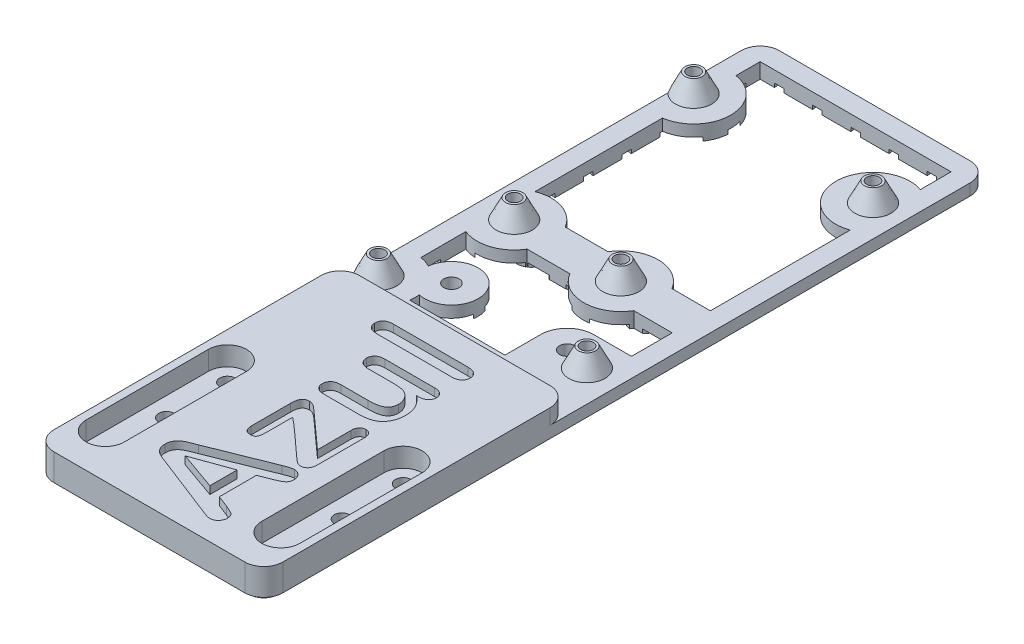
from build123d import *

# Parameters (mm, degrees)
SKETCH1_W           = 60
SKETCH1_H           = 190
SKETCH1_R           = 1.65
BOSS_EXTRUDE1_DEPTH = 4
SKETCH2_R           = 2.25
SKETCH2_R_2         = 1.65
BOSS_EXTRUDE2_DEPTH = 5
CHAMFER1_SIZE       = 2.5
CHAMFER1_SIZE_2     = 5
FILLET1_R           = 5
SKETCH4_R           = 3.75
CUT_EXTRUDE1_DEPTH  = 1
BOSS_EXTRUDE3_START = 4
BOSS_EXTRUDE3_DEPTH = 4
SKETCH7_R           = 2
CUT_EXTRUDE2_DEPTH  = 115.297856498
CUT_EXTRUDE3_DEPTH  = 5
SKETCH9_R           = 2
CUT_EXTRUDE4_DEPTH  = 115.127122105
SKETCH10_R          = 4
CUT_EXTRUDE5_DEPTH  = 115.127122105
CUT_EXTRUDE6_DEPTH  = 2
FILLET2_R           = 5
CUT_EXTRUDE7_DEPTH  = 115.127122136


with BuildPart() as part:
    # Sketch1 → Boss-Extrude1 (new body)
    with BuildSketch(Plane(origin=(0, 0, 0), x_dir=(1, 0, 0), z_dir=(0, 1, 0))):
        with Locations((0, 15)):
            Rectangle(SKETCH1_W, SKETCH1_H)
        with Locations(Location((-26.46, 89.03, 0), (0, 0, 270))):
            Circle(SKETCH1_R, mode=Mode.SUBTRACT)
        with Locations(Location((21.8, 87.76, 0), (0, 0, 270))):
            Circle(SKETCH1_R, mode=Mode.SUBTRACT)
        with Locations(Location((-21.38, 36.96, 0), (0, 0, 270))):
            Circle(SKETCH1_R, mode=Mode.SUBTRACT)
        with Locations(Location((6.56, 36.96, 0), (0, 0, 270))):
            Circle(SKETCH1_R, mode=Mode.SUBTRACT)
        with Locations(Location((-26.46, 6.48, 0), (0, 0, 270))):
            Circle(SKETCH1_R, mode=Mode.SUBTRACT)
        with Locations(Location((21.8, 12.83, 0), (0, 0, 270))):
            Circle(SKETCH1_R, mode=Mode.SUBTRACT)
    extrude(amount=BOSS_EXTRUDE1_DEPTH)

    # Sketch2 → Boss-Extrude2 (add)
    # profile 1 of 6: a face of its own
    with BuildSketch(Plane(origin=(0, 4, 0), x_dir=(1, 0, 0), z_dir=(0, 1, 0))):
        with Locations(Location((-26.46, 89.03, 0), (0, 0, 270))):
            Circle(SKETCH2_R)
        with Locations(Location((-26.46, 89.03, 0), (0, 0, 270))):
            Circle(SKETCH2_R_2, mode=Mode.SUBTRACT)
    # profile 2 of 6: a face of its own
    with BuildSketch(Plane(origin=(0, 4, 0), x_dir=(1, 0, 0), z_dir=(0, 1, 0))):
        with Locations(Location((21.8, 87.76, 0), (0, 0, 270))):
            Circle(SKETCH2_R)
        with Locations(Location((21.8, 87.76, 0), (0, 0, 270))):
            Circle(SKETCH2_R_2, mode=Mode.SUBTRACT)
    # profile 3 of 6: a face of its own
    with BuildSketch(Plane(origin=(0, 4, 0), x_dir=(1, 0, 0), z_dir=(0, 1, 0))):
        with Locations(Location((-21.38, 36.96, 0), (0, 0, 270))):
            Circle(SKETCH2_R)
        with Locations(Location((-21.38, 36.96, 0), (0, 0, 270))):
            Circle(SKETCH2_R_2, mode=Mode.SUBTRACT)
    # profile 4 of 6: a face of its own
    with BuildSketch(Plane(origin=(0, 4, 0), x_dir=(1, 0, 0), z_dir=(0, 1, 0))):
        with Locations(Location((6.56, 36.96, 0), (0, 0, 270))):
            Circle(SKETCH2_R)
        with Locations(Location((6.56, 36.96, 0), (0, 0, 270))):
            Circle(SKETCH2_R_2, mode=Mode.SUBTRACT)
    # profile 5 of 6: a face of its own
    with BuildSketch(Plane(origin=(0, 4, 0), x_dir=(1, 0, 0), z_dir=(0, 1, 0))):
        with Locations(Location((21.8, 12.83, 0), (0, 0, 270))):
            Circle(SKETCH2_R)
        with Locations(Location((21.8, 12.83, 0), (0, 0, 270))):
            Circle(SKETCH2_R_2, mode=Mode.SUBTRACT)
    # profile 6 of 6: a face of its own
    with BuildSketch(Plane(origin=(0, 4, 0), x_dir=(1, 0, 0), z_dir=(0, 1, 0))):
        with Locations(Location((-26.46, 6.48, 0), (0, 0, 270))):
            Circle(SKETCH2_R)
        with Locations(Location((-26.46, 6.48, 0), (0, 0, 270))):
            Circle(SKETCH2_R_2, mode=Mode.SUBTRACT)
    extrude(amount=BOSS_EXTRUDE2_DEPTH)

    # Chamfer1
    # the kernel refuses this chamfer: 5, 2.5 mm, written as the material it adds along each edge
    with BuildSketch(Plane(origin=(-26.46, 4, -89.03), x_dir=(0, 0, 1), z_dir=(-1, 0, 0))) as chamfer1_piece_1_section:
        Polygon((2.25 + CHAMFER1_SIZE, 0), (2.25, CHAMFER1_SIZE_2), (2.25, 0), align=None)
    chamfer1_piece_1 = revolve(axis=Axis((-26.46, 4, -89.03), (0, 1, 0)), mode=Mode.PRIVATE)
    chamfer1_piece_1 = split(chamfer1_piece_1, bisect_by=Plane(origin=(-30, 6.387860217, -92.529327231), z_dir=(1, 0, 0)), keep=Keep.TOP, mode=Mode.PRIVATE)
    chamfer1_piece_1 = split(chamfer1_piece_1, bisect_by=Plane(origin=(-26.46, 9, -92.529327231), z_dir=(0, -1, 0)), keep=Keep.TOP, mode=Mode.PRIVATE)
    add(chamfer1_piece_1)
    with BuildSketch(Plane(origin=(21.8, 4, -87.76), x_dir=(0, 0, 1), z_dir=(-1, 0, 0))) as chamfer1_piece_2_section:
        Polygon((2.25 + CHAMFER1_SIZE, 0), (2.25, CHAMFER1_SIZE_2), (2.25, 0), align=None)
    chamfer1_piece_2 = revolve(axis=Axis((21.8, 4, -87.76), (0, 1, 0)), mode=Mode.PRIVATE)
    chamfer1_piece_2 = split(chamfer1_piece_2, bisect_by=Plane(origin=(21.8, 9, -91.258639917), z_dir=(0, -1, 0)), keep=Keep.TOP, mode=Mode.PRIVATE)
    add(chamfer1_piece_2)
    with BuildSketch(Plane(origin=(-21.38, 4, -36.96), x_dir=(0, 0, 1), z_dir=(-1, 0, 0))) as chamfer1_piece_3_section:
        Polygon((2.25 + CHAMFER1_SIZE, 0), (2.25, CHAMFER1_SIZE_2), (2.25, 0), align=None)
    chamfer1_piece_3 = revolve(axis=Axis((-21.38, 4, -36.96), (0, 1, 0)), mode=Mode.PRIVATE)
    chamfer1_piece_3 = split(chamfer1_piece_3, bisect_by=Plane(origin=(-21.38, 9, -40.458639916), z_dir=(0, -1, 0)), keep=Keep.TOP, mode=Mode.PRIVATE)
    add(chamfer1_piece_3)
    with BuildSketch(Plane(origin=(6.56, 4, -36.96), x_dir=(0, 0, 1), z_dir=(-1, 0, 0))) as chamfer1_piece_4_section:
        Polygon((2.25 + CHAMFER1_SIZE, 0), (2.25, CHAMFER1_SIZE_2), (2.25, 0), align=None)
    chamfer1_piece_4 = revolve(axis=Axis((6.56, 4, -36.96), (0, 1, 0)), mode=Mode.PRIVATE)
    chamfer1_piece_4 = split(chamfer1_piece_4, bisect_by=Plane(origin=(6.56, 9, -40.458639914), z_dir=(0, -1, 0)), keep=Keep.TOP, mode=Mode.PRIVATE)
    add(chamfer1_piece_4)
    with BuildSketch(Plane(origin=(21.8, 4, -12.83), x_dir=(0, 0, 1), z_dir=(-1, 0, 0))) as chamfer1_piece_5_section:
        Polygon((2.25 + CHAMFER1_SIZE, 0), (2.25, CHAMFER1_SIZE_2), (2.25, 0), align=None)
    chamfer1_piece_5 = revolve(axis=Axis((21.8, 4, -12.83), (0, 1, 0)), mode=Mode.PRIVATE)
    chamfer1_piece_5 = split(chamfer1_piece_5, bisect_by=Plane(origin=(21.8, 9, -16.328639917), z_dir=(0, -1, 0)), keep=Keep.TOP, mode=Mode.PRIVATE)
    add(chamfer1_piece_5)
    with BuildSketch(Plane(origin=(-26.46, 4, -6.48), x_dir=(0, 0, 1), z_dir=(-1, 0, 0))) as chamfer1_piece_6_section:
        Polygon((2.25 + CHAMFER1_SIZE, 0), (2.25, CHAMFER1_SIZE_2), (2.25, 0), align=None)
    chamfer1_piece_6 = revolve(axis=Axis((-26.46, 4, -6.48), (0, 1, 0)), mode=Mode.PRIVATE)
    chamfer1_piece_6 = split(chamfer1_piece_6, bisect_by=Plane(origin=(-30, 6.387860216, -9.97932723), z_dir=(1, 0, 0)), keep=Keep.TOP, mode=Mode.PRIVATE)
    chamfer1_piece_6 = split(chamfer1_piece_6, bisect_by=Plane(origin=(-26.46, 9, -9.97932723), z_dir=(0, -1, 0)), keep=Keep.TOP, mode=Mode.PRIVATE)
    add(chamfer1_piece_6)

    # Fillet1
    fillet1_edges = [part.edges().sort_by_distance(p)[0] for p in [
        (30, 2, 80),
        (-30, 2, 80),
        (-30, 2, -110),
        (30, 2, -110),
    ]]
    fillet(fillet1_edges, radius=FILLET1_R)

    # Sketch4 → Cut-Extrude1 (cut)
    # profile 1 of 115: a face of its own
    with BuildSketch(Plane.XZ):
        with Locations((-85, 75)):
            Circle(SKETCH4_R)
    # profile 2 of 115: a face of its own
    with BuildSketch(Plane.XZ):
        with Locations((-75, 75)):
            Circle(SKETCH4_R)
    # profile 3 of 115: a face of its own
    with BuildSketch(Plane.XZ):
        with Locations((-65, 75)):
            Circle(SKETCH4_R)
    # profile 4 of 115: a face of its own
    with BuildSketch(Plane.XZ):
        with Locations((-55, 75)):
            Circle(SKETCH4_R)
    # profile 5 of 115: a face of its own
    with BuildSketch(Plane.XZ):
        with Locations((-45, 75)):
            Circle(SKETCH4_R)
    # profile 6 of 115: a face of its own
    with BuildSketch(Plane.XZ):
        with Locations((-35, 75)):
            Circle(SKETCH4_R)
    # profile 7 of 115: a face of its own
    with BuildSketch(Plane.XZ):
        with Locations((-75, 65)):
            Circle(SKETCH4_R)
    # profile 8 of 115: a face of its own
    with BuildSketch(Plane.XZ):
        with Locations((-65, 65)):
            Circle(SKETCH4_R)
    # profile 9 of 115: a face of its own
    with BuildSketch(Plane.XZ):
        with Locations((-55, 65)):
            Circle(SKETCH4_R)
    # profile 10 of 115: a face of its own
    with BuildSketch(Plane.XZ):
        with Locations((-45, 65)):
            Circle(SKETCH4_R)
    # profile 11 of 115: a face of its own
    with BuildSketch(Plane.XZ):
        with Locations((-35, 65)):
            Circle(SKETCH4_R)
    # profile 12 of 115: a face of its own
    with BuildSketch(Plane.XZ):
        with Locations((-75, 55)):
            Circle(SKETCH4_R)
    # profile 13 of 115: a face of its own
    with BuildSketch(Plane.XZ):
        with Locations((-65, 55)):
            Circle(SKETCH4_R)
    # profile 14 of 115: a face of its own
    with BuildSketch(Plane.XZ):
        with Locations((-55, 55)):
            Circle(SKETCH4_R)
    # profile 15 of 115: a face of its own
    with BuildSketch(Plane.XZ):
        with Locations((-45, 55)):
            Circle(SKETCH4_R)
    # profile 16 of 115: a face of its own
    with BuildSketch(Plane.XZ):
        with Locations((-35, 55)):
            Circle(SKETCH4_R)
    # profile 17 of 115: a face of its own
    with BuildSketch(Plane.XZ):
        with Locations((-75, 45)):
            Circle(SKETCH4_R)
    # profile 18 of 115: a face of its own
    with BuildSketch(Plane.XZ):
        with Locations((-65, 45)):
            Circle(SKETCH4_R)
    # profile 19 of 115: a face of its own
    with BuildSketch(Plane.XZ):
        with Locations((-55, 45)):
            Circle(SKETCH4_R)
    # profile 20 of 115: a face of its own
    with BuildSketch(Plane.XZ):
        with Locations((-45, 45)):
            Circle(SKETCH4_R)
    # profile 21 of 115: a face of its own
    with BuildSketch(Plane.XZ):
        with Locations((-35, 45)):
            Circle(SKETCH4_R)
    # profile 22 of 115: a face of its own
    with BuildSketch(Plane.XZ):
        with Locations((-75, 35)):
            Circle(SKETCH4_R)
    # profile 23 of 115: a face of its own
    with BuildSketch(Plane.XZ):
        with Locations((-65, 35)):
            Circle(SKETCH4_R)
    # profile 24 of 115: a face of its own
    with BuildSketch(Plane.XZ):
        with Locations((-55, 35)):
            Circle(SKETCH4_R)
    # profile 25 of 115: a face of its own
    with BuildSketch(Plane.XZ):
        with Locations((-45, 35)):
            Circle(SKETCH4_R)
    # profile 26 of 115: a face of its own
    with BuildSketch(Plane.XZ):
        with Locations((-35, 35)):
            Circle(SKETCH4_R)
    # profile 27 of 115: a face of its own
    with BuildSketch(Plane.XZ):
        with Locations((-75, 25)):
            Circle(SKETCH4_R)
    # profile 28 of 115: a face of its own
    with BuildSketch(Plane.XZ):
        with Locations((-65, 25)):
            Circle(SKETCH4_R)
    # profile 29 of 115: a face of its own
    with BuildSketch(Plane.XZ):
        with Locations((-55, 25)):
            Circle(SKETCH4_R)
    # profile 30 of 115: a face of its own
    with BuildSketch(Plane.XZ):
        with Locations((-45, 25)):
            Circle(SKETCH4_R)
    # profile 31 of 115: a face of its own
    with BuildSketch(Plane.XZ):
        with Locations((-35, 25)):
            Circle(SKETCH4_R)
    # profile 32 of 115: a face of its own
    with BuildSketch(Plane.XZ):
        with Locations((-75, 15)):
            Circle(SKETCH4_R)
    # profile 33 of 115: a face of its own
    with BuildSketch(Plane.XZ):
        with Locations((-65, 15)):
            Circle(SKETCH4_R)
    # profile 34 of 115: a face of its own
    with BuildSketch(Plane.XZ):
        with Locations((-55, 15)):
            Circle(SKETCH4_R)
    # profile 35 of 115: a face of its own
    with BuildSketch(Plane.XZ):
        with Locations((-45, 15)):
            Circle(SKETCH4_R)
    # profile 36 of 115: a face of its own
    with BuildSketch(Plane.XZ):
        with Locations((-35, 15)):
            Circle(SKETCH4_R)
    # profile 37 of 115: a face of its own
    with BuildSketch(Plane.XZ):
        with Locations((-75, 5)):
            Circle(SKETCH4_R)
    # profile 38 of 115: a face of its own
    with BuildSketch(Plane.XZ):
        with Locations((-65, 5)):
            Circle(SKETCH4_R)
    # profile 39 of 115: a face of its own
    with BuildSketch(Plane.XZ):
        with Locations((-55, 5)):
            Circle(SKETCH4_R)
    # profile 40 of 115: a face of its own
    with BuildSketch(Plane.XZ):
        with Locations((-45, 5)):
            Circle(SKETCH4_R)
    # profile 41 of 115: a face of its own
    with BuildSketch(Plane.XZ):
        with Locations((-35, 5)):
            Circle(SKETCH4_R)
    # profile 42 of 115: a face of its own
    with BuildSketch(Plane.XZ):
        with Locations((-75, -5)):
            Circle(SKETCH4_R)
    # profile 43 of 115: a face of its own
    with BuildSketch(Plane.XZ):
        with Locations((-65, -5)):
            Circle(SKETCH4_R)
    # profile 44 of 115: a face of its own
    with BuildSketch(Plane.XZ):
        with Locations((-55, -5)):
            Circle(SKETCH4_R)
    # profile 45 of 115: a face of its own
    with BuildSketch(Plane.XZ):
        with Locations((-45, -5)):
            Circle(SKETCH4_R)
    # profile 46 of 115: a face of its own
    with BuildSketch(Plane.XZ):
        with Locations((-35, -5)):
            Circle(SKETCH4_R)
    # profile 47 of 115: a face of its own
    with BuildSketch(Plane.XZ):
        with Locations((-75, -15)):
            Circle(SKETCH4_R)
    # profile 48 of 115: a face of its own
    with BuildSketch(Plane.XZ):
        with Locations((-65, -15)):
            Circle(SKETCH4_R)
    # profile 49 of 115: a face of its own
    with BuildSketch(Plane.XZ):
        with Locations((-55, -15)):
            Circle(SKETCH4_R)
    # profile 50 of 115: a face of its own
    with BuildSketch(Plane.XZ):
        with Locations((-45, -15)):
            Circle(SKETCH4_R)
    # profile 51 of 115: a face of its own
    with BuildSketch(Plane.XZ):
        with Locations((-35, -15)):
            Circle(SKETCH4_R)
    # profile 52 of 115: a face of its own
    with BuildSketch(Plane.XZ):
        with Locations((-75, -25)):
            Circle(SKETCH4_R)
    # profile 53 of 115: a face of its own
    with BuildSketch(Plane.XZ):
        with Locations((-65, -25)):
            Circle(SKETCH4_R)
    # profile 54 of 115: a face of its own
    with BuildSketch(Plane.XZ):
        with Locations((-55, -25)):
            Circle(SKETCH4_R)
    # profile 55 of 115: a face of its own
    with BuildSketch(Plane.XZ):
        with Locations((-45, -25)):
            Circle(SKETCH4_R)
    # profile 56 of 115: a face of its own
    with BuildSketch(Plane.XZ):
        with Locations((-35, -25)):
            Circle(SKETCH4_R)
    # profile 57 of 115: a face of its own
    with BuildSketch(Plane.XZ):
        with Locations((-85, 65)):
            Circle(SKETCH4_R)
    # profile 58 of 115: a face of its own
    with BuildSketch(Plane.XZ):
        with Locations((-85, 55)):
            Circle(SKETCH4_R)
    # profile 59 of 115: a face of its own
    with BuildSketch(Plane.XZ):
        with Locations((-85, 45)):
            Circle(SKETCH4_R)
    # profile 60 of 115: a face of its own
    with BuildSketch(Plane.XZ):
        with Locations((-85, 35)):
            Circle(SKETCH4_R)
    # profile 61 of 115: a face of its own
    with BuildSketch(Plane.XZ):
        with Locations((-85, 25)):
            Circle(SKETCH4_R)
    # profile 62 of 115: a face of its own
    with BuildSketch(Plane.XZ):
        with Locations((-85, 15)):
            Circle(SKETCH4_R)
    # profile 63 of 115: a face of its own
    with BuildSketch(Plane.XZ):
        with Locations((-85, 5)):
            Circle(SKETCH4_R)
    # profile 64 of 115: a face of its own
    with BuildSketch(Plane.XZ):
        with Locations((-85, -5)):
            Circle(SKETCH4_R)
    # profile 65 of 115: a face of its own
    with BuildSketch(Plane.XZ):
        with Locations((-85, -15)):
            Circle(SKETCH4_R)
    # profile 66 of 115: a face of its own
    with BuildSketch(Plane.XZ):
        with Locations((-85, -25)):
            Circle(SKETCH4_R)
    # profile 67 of 115: a face of its own
    with BuildSketch(Plane.XZ):
        with Locations((-85, -35)):
            Circle(SKETCH4_R)
    # profile 68 of 115: a face of its own
    with BuildSketch(Plane.XZ):
        with Locations((-75, -35)):
            Circle(SKETCH4_R)
    # profile 69 of 115: a face of its own
    with BuildSketch(Plane.XZ):
        with Locations((-65, -35)):
            Circle(SKETCH4_R)
    # profile 70 of 115: a face of its own
    with BuildSketch(Plane.XZ):
        with Locations((-55, -35)):
            Circle(SKETCH4_R)
    # profile 71 of 115: a face of its own
    with BuildSketch(Plane.XZ):
        with Locations((-45, -35)):
            Circle(SKETCH4_R)
    # profile 72 of 115: a face of its own
    with BuildSketch(Plane.XZ):
        with Locations((-35, -35)):
            Circle(SKETCH4_R)
    # profile 73 of 115: a face of its own
    with BuildSketch(Plane.XZ):
        with Locations((-85, -45)):
            Circle(SKETCH4_R)
    # profile 74 of 115: a face of its own
    with BuildSketch(Plane.XZ):
        with Locations((-75, -45)):
            Circle(SKETCH4_R)
    # profile 75 of 115: a face of its own
    with BuildSketch(Plane.XZ):
        with Locations((-65, -45)):
            Circle(SKETCH4_R)
    # profile 76 of 115: a face of its own
    with BuildSketch(Plane.XZ):
        with Locations((-55, -45)):
            Circle(SKETCH4_R)
    # profile 77 of 115: a face of its own
    with BuildSketch(Plane.XZ):
        with Locations((-45, -45)):
            Circle(SKETCH4_R)
    # profile 78 of 115: a face of its own
    with BuildSketch(Plane.XZ):
        with Locations((-35, -45)):
            Circle(SKETCH4_R)
    # profile 79 of 115: a face of its own
    with BuildSketch(Plane.XZ):
        with Locations((-85, -55)):
            Circle(SKETCH4_R)
    # profile 80 of 115: a face of its own
    with BuildSketch(Plane.XZ):
        with Locations((-75, -55)):
            Circle(SKETCH4_R)
    # profile 81 of 115: a face of its own
    with BuildSketch(Plane.XZ):
        with Locations((-65, -55)):
            Circle(SKETCH4_R)
    # profile 82 of 115: a face of its own
    with BuildSketch(Plane.XZ):
        with Locations((-55, -55)):
            Circle(SKETCH4_R)
    # profile 83 of 115: a face of its own
    with BuildSketch(Plane.XZ):
        with Locations((-45, -55)):
            Circle(SKETCH4_R)
    # profile 84 of 115: a face of its own
    with BuildSketch(Plane.XZ):
        with Locations((-35, -55)):
            Circle(SKETCH4_R)
    # profile 85 of 115: a face of its own
    with BuildSketch(Plane.XZ):
        with Locations((-85, -65)):
            Circle(SKETCH4_R)
    # profile 86 of 115: a face of its own
    with BuildSketch(Plane.XZ):
        with Locations((-75, -65)):
            Circle(SKETCH4_R)
    # profile 87 of 115: a face of its own
    with BuildSketch(Plane.XZ):
        with Locations((-65, -65)):
            Circle(SKETCH4_R)
    # profile 88 of 115: a face of its own
    with BuildSketch(Plane.XZ):
        with Locations((-55, -65)):
            Circle(SKETCH4_R)
    # profile 89 of 115: a face of its own
    with BuildSketch(Plane.XZ):
        with Locations((-45, -65)):
            Circle(SKETCH4_R)
    # profile 90 of 115: a face of its own
    with BuildSketch(Plane.XZ):
        with Locations((-35, -65)):
            Circle(SKETCH4_R)
    # profile 91 of 115: a face of its own
    with BuildSketch(Plane.XZ):
        with Locations((-85, -75)):
            Circle(SKETCH4_R)
    # profile 92 of 115: a face of its own
    with BuildSketch(Plane.XZ):
        with Locations((-75, -75)):
            Circle(SKETCH4_R)
    # profile 93 of 115: a face of its own
    with BuildSketch(Plane.XZ):
        with Locations((-65, -75)):
            Circle(SKETCH4_R)
    # profile 94 of 115: a face of its own
    with BuildSketch(Plane.XZ):
        with Locations((-55, -75)):
            Circle(SKETCH4_R)
    # profile 95 of 115: a face of its own
    with BuildSketch(Plane.XZ):
        with Locations((-45, -75)):
            Circle(SKETCH4_R)
    # profile 96 of 115: a face of its own
    with BuildSketch(Plane.XZ):
        with Locations((-35, -75)):
            Circle(SKETCH4_R)
    # profile 97 of 115: a face of its own
    with BuildSketch(Plane.XZ):
        with Locations((-85, -85)):
            Circle(SKETCH4_R)
    # profile 98 of 115: a face of its own
    with BuildSketch(Plane.XZ):
        with Locations((-75, -85)):
            Circle(SKETCH4_R)
    # profile 99 of 115: a face of its own
    with BuildSketch(Plane.XZ):
        with Locations((-65, -85)):
            Circle(SKETCH4_R)
    # profile 100 of 115: a face of its own
    with BuildSketch(Plane.XZ):
        with Locations((-55, -85)):
            Circle(SKETCH4_R)
    # profile 101 of 115: a face of its own
    with BuildSketch(Plane.XZ):
        with Locations((-45, -85)):
            Circle(SKETCH4_R)
    # profile 102 of 115: a face of its own
    with BuildSketch(Plane.XZ):
        with Locations((-35, -85)):
            Circle(SKETCH4_R)
    # profile 103 of 115: a face of its own
    with BuildSketch(Plane.XZ):
        with Locations((-85, -95)):
            Circle(SKETCH4_R)
    # profile 104 of 115: a face of its own
    with BuildSketch(Plane.XZ):
        with Locations((-75, -95)):
            Circle(SKETCH4_R)
    # profile 105 of 115: a face of its own
    with BuildSketch(Plane.XZ):
        with Locations((-65, -95)):
            Circle(SKETCH4_R)
    # profile 106 of 115: a face of its own
    with BuildSketch(Plane.XZ):
        with Locations((-55, -95)):
            Circle(SKETCH4_R)
    # profile 107 of 115: a face of its own
    with BuildSketch(Plane.XZ):
        with Locations((-45, -95)):
            Circle(SKETCH4_R)
    # profile 108 of 115: a face of its own
    with BuildSketch(Plane.XZ):
        with Locations((-35, -95)):
            Circle(SKETCH4_R)
    # profile 109 of 115: a face of its own
    with BuildSketch(Plane.XZ):
        with Locations((-85, -105)):
            Circle(SKETCH4_R)
    # profile 110 of 115: a face of its own
    with BuildSketch(Plane.XZ):
        with Locations((-75, -105)):
            Circle(SKETCH4_R)
    # profile 111 of 115: a face of its own
    with BuildSketch(Plane.XZ):
        with Locations((-65, -105)):
            Circle(SKETCH4_R)
    # profile 112 of 115: a face of its own
    with BuildSketch(Plane.XZ):
        with Locations((-55, -105)):
            Circle(SKETCH4_R)
    # profile 113 of 115: a face of its own
    with BuildSketch(Plane.XZ):
        with Locations((-45, -105)):
            Circle(SKETCH4_R)
    # profile 114 of 115: a face of its own
    with BuildSketch(Plane.XZ):
        with Locations((-35, -105)):
            Circle(SKETCH4_R)
    # profile 115 of 115: a face of its own
    with BuildSketch(Plane.XZ):
        with BuildLine():
            Line((30, -105), (30, 75))
            ThreePointArc((30, 75), (28.535533906, 78.535533906), (25, 80))
            Line((25, 80), (-25, 80))
            ThreePointArc((-25, 80), (-28.535533906, 78.535533906), (-30, 75))
            Line((-30, 75), (-30, -105))
            ThreePointArc((-30, -105), (-28.535533906, -108.535533906), (-25, -110))
            Line((-25, -110), (25, -110))
            ThreePointArc((25, -110), (28.535533906, -108.535533906), (30, -105))
        make_face()
        with Locations(Location((-25, 75, 0), (0, 0, 270))):
            Circle(SKETCH4_R, mode=Mode.SUBTRACT)
        with Locations(Location((-15, 75, 0), (0, 0, 270))):
            Circle(SKETCH4_R, mode=Mode.SUBTRACT)
        with Locations(Location((-5, 75, 0), (0, 0, 270))):
            Circle(SKETCH4_R, mode=Mode.SUBTRACT)
        with Locations(Location((5, 75, 0), (0, 0, 270))):
            Circle(SKETCH4_R, mode=Mode.SUBTRACT)
        with Locations(Location((15, 75, 0), (0, 0, 270))):
            Circle(SKETCH4_R, mode=Mode.SUBTRACT)
        with Locations(Location((25, 75, 0), (0, 0, 270))):
            Circle(SKETCH4_R, mode=Mode.SUBTRACT)
        with Locations(Location((-25, 65, 0), (0, 0, 270))):
            Circle(SKETCH4_R, mode=Mode.SUBTRACT)
        with Locations(Location((-15, 65, 0), (0, 0, 270))):
            Circle(SKETCH4_R, mode=Mode.SUBTRACT)
        with Locations(Location((-5, 65, 0), (0, 0, 270))):
            Circle(SKETCH4_R, mode=Mode.SUBTRACT)
        with Locations(Location((5, 65, 0), (0, 0, 270))):
            Circle(SKETCH4_R, mode=Mode.SUBTRACT)
        with Locations(Location((15, 65, 0), (0, 0, 270))):
            Circle(SKETCH4_R, mode=Mode.SUBTRACT)
        with Locations(Location((25, 65, 0), (0, 0, 270))):
            Circle(SKETCH4_R, mode=Mode.SUBTRACT)
        with Locations(Location((-25, 55, 0), (0, 0, 270))):
            Circle(SKETCH4_R, mode=Mode.SUBTRACT)
        with Locations(Location((-15, 55, 0), (0, 0, 270))):
            Circle(SKETCH4_R, mode=Mode.SUBTRACT)
        with Locations(Location((-5, 55, 0), (0, 0, 270))):
            Circle(SKETCH4_R, mode=Mode.SUBTRACT)
        with Locations(Location((5, 55, 0), (0, 0, 270))):
            Circle(SKETCH4_R, mode=Mode.SUBTRACT)
        with Locations(Location((15, 55, 0), (0, 0, 270))):
            Circle(SKETCH4_R, mode=Mode.SUBTRACT)
        with Locations(Location((25, 55, 0), (0, 0, 270))):
            Circle(SKETCH4_R, mode=Mode.SUBTRACT)
        with Locations(Location((-25, 45, 0), (0, 0, 270))):
            Circle(SKETCH4_R, mode=Mode.SUBTRACT)
        with Locations(Location((-15, 45, 0), (0, 0, 270))):
            Circle(SKETCH4_R, mode=Mode.SUBTRACT)
        with Locations(Location((-5, 45, 0), (0, 0, 270))):
            Circle(SKETCH4_R, mode=Mode.SUBTRACT)
        with Locations(Location((5, 45, 0), (0, 0, 270))):
            Circle(SKETCH4_R, mode=Mode.SUBTRACT)
        with Locations(Location((15, 45, 0), (0, 0, 270))):
            Circle(SKETCH4_R, mode=Mode.SUBTRACT)
        with Locations(Location((25, 45, 0), (0, 0, 270))):
            Circle(SKETCH4_R, mode=Mode.SUBTRACT)
        with Locations(Location((-25, 35, 0), (0, 0, 270))):
            Circle(SKETCH4_R, mode=Mode.SUBTRACT)
        with Locations(Location((-15, 35, 0), (0, 0, 270))):
            Circle(SKETCH4_R, mode=Mode.SUBTRACT)
        with Locations(Location((-5, 35, 0), (0, 0, 270))):
            Circle(SKETCH4_R, mode=Mode.SUBTRACT)
        with Locations(Location((5, 35, 0), (0, 0, 270))):
            Circle(SKETCH4_R, mode=Mode.SUBTRACT)
        with Locations(Location((15, 35, 0), (0, 0, 270))):
            Circle(SKETCH4_R, mode=Mode.SUBTRACT)
        with Locations(Location((25, 35, 0), (0, 0, 270))):
            Circle(SKETCH4_R, mode=Mode.SUBTRACT)
        with Locations(Location((-25, 25, 0), (0, 0, 270))):
            Circle(SKETCH4_R, mode=Mode.SUBTRACT)
        with Locations(Location((-15, 25, 0), (0, 0, 270))):
            Circle(SKETCH4_R, mode=Mode.SUBTRACT)
        with Locations(Location((-5, 25, 0), (0, 0, 270))):
            Circle(SKETCH4_R, mode=Mode.SUBTRACT)
        with Locations(Location((5, 25, 0), (0, 0, 270))):
            Circle(SKETCH4_R, mode=Mode.SUBTRACT)
        with Locations(Location((15, 25, 0), (0, 0, 270))):
            Circle(SKETCH4_R, mode=Mode.SUBTRACT)
        with Locations(Location((25, 25, 0), (0, 0, 270))):
            Circle(SKETCH4_R, mode=Mode.SUBTRACT)
        with Locations(Location((-25, 15, 0), (0, 0, 270))):
            Circle(SKETCH4_R, mode=Mode.SUBTRACT)
        with Locations(Location((-15, 15, 0), (0, 0, 270))):
            Circle(SKETCH4_R, mode=Mode.SUBTRACT)
        with Locations(Location((-5, 15, 0), (0, 0, 270))):
            Circle(SKETCH4_R, mode=Mode.SUBTRACT)
        with Locations(Location((5, 15, 0), (0, 0, 270))):
            Circle(SKETCH4_R, mode=Mode.SUBTRACT)
        with Locations(Location((15, 15, 0), (0, 0, 270))):
            Circle(SKETCH4_R, mode=Mode.SUBTRACT)
        with Locations(Location((25, 15, 0), (0, 0, 270))):
            Circle(SKETCH4_R, mode=Mode.SUBTRACT)
        with Locations(Location((-25, 5, 0), (0, 0, 270))):
            Circle(SKETCH4_R, mode=Mode.SUBTRACT)
        with Locations(Location((-15, 5, 0), (0, 0, 270))):
            Circle(SKETCH4_R, mode=Mode.SUBTRACT)
        with Locations(Location((-5, 5, 0), (0, 0, 270))):
            Circle(SKETCH4_R, mode=Mode.SUBTRACT)
        with Locations(Location((5, 5, 0), (0, 0, 270))):
            Circle(SKETCH4_R, mode=Mode.SUBTRACT)
        with Locations(Location((15, 5, 0), (0, 0, 270))):
            Circle(SKETCH4_R, mode=Mode.SUBTRACT)
        with Locations(Location((25, 5, 0), (0, 0, 270))):
            Circle(SKETCH4_R, mode=Mode.SUBTRACT)
        with Locations(Location((-25, -5, 0), (0, 0, 270))):
            Circle(SKETCH4_R, mode=Mode.SUBTRACT)
        with Locations(Location((-15, -5, 0), (0, 0, 270))):
            Circle(SKETCH4_R, mode=Mode.SUBTRACT)
        with Locations(Location((-5, -5, 0), (0, 0, 270))):
            Circle(SKETCH4_R, mode=Mode.SUBTRACT)
        with Locations(Location((5, -5, 0), (0, 0, 270))):
            Circle(SKETCH4_R, mode=Mode.SUBTRACT)
        with Locations(Location((15, -5, 0), (0, 0, 270))):
            Circle(SKETCH4_R, mode=Mode.SUBTRACT)
        with Locations(Location((25, -5, 0), (0, 0, 270))):
            Circle(SKETCH4_R, mode=Mode.SUBTRACT)
        with Locations(Location((-25, -15, 0), (0, 0, 270))):
            Circle(SKETCH4_R, mode=Mode.SUBTRACT)
        with Locations(Location((-15, -15, 0), (0, 0, 270))):
            Circle(SKETCH4_R, mode=Mode.SUBTRACT)
        with Locations(Location((-5, -15, 0), (0, 0, 270))):
            Circle(SKETCH4_R, mode=Mode.SUBTRACT)
        with Locations(Location((5, -15, 0), (0, 0, 270))):
            Circle(SKETCH4_R, mode=Mode.SUBTRACT)
        with Locations(Location((15, -15, 0), (0, 0, 270))):
            Circle(SKETCH4_R, mode=Mode.SUBTRACT)
        with Locations((25, -15)):
            Circle(SKETCH4_R, mode=Mode.SUBTRACT)
        with Locations(Location((-25, -25, 0), (0, 0, 270))):
            Circle(SKETCH4_R, mode=Mode.SUBTRACT)
        with Locations(Location((-15, -25, 0), (0, 0, 270))):
            Circle(SKETCH4_R, mode=Mode.SUBTRACT)
        with Locations(Location((-5, -25, 0), (0, 0, 270))):
            Circle(SKETCH4_R, mode=Mode.SUBTRACT)
        with Locations(Location((5, -25, 0), (0, 0, 270))):
            Circle(SKETCH4_R, mode=Mode.SUBTRACT)
        with Locations(Location((15, -25, 0), (0, 0, 270))):
            Circle(SKETCH4_R, mode=Mode.SUBTRACT)
        with Locations(Location((25, -25, 0), (0, 0, 270))):
            Circle(SKETCH4_R, mode=Mode.SUBTRACT)
        with Locations((-25, -35)):
            Circle(SKETCH4_R, mode=Mode.SUBTRACT)
        with Locations(Location((-15, -35, 0), (0, 0, 270))):
            Circle(SKETCH4_R, mode=Mode.SUBTRACT)
        with Locations(Location((-5, -35, 0), (0, 0, 270))):
            Circle(SKETCH4_R, mode=Mode.SUBTRACT)
        with Locations((5, -35)):
            Circle(SKETCH4_R, mode=Mode.SUBTRACT)
        with Locations(Location((15, -35, 0), (0, 0, 270))):
            Circle(SKETCH4_R, mode=Mode.SUBTRACT)
        with Locations(Location((25, -35, 0), (0, 0, 270))):
            Circle(SKETCH4_R, mode=Mode.SUBTRACT)
        with Locations(Location((-25, -45, 0), (0, 0, 270))):
            Circle(SKETCH4_R, mode=Mode.SUBTRACT)
        with Locations(Location((-15, -45, 0), (0, 0, 270))):
            Circle(SKETCH4_R, mode=Mode.SUBTRACT)
        with Locations(Location((-5, -45, 0), (0, 0, 270))):
            Circle(SKETCH4_R, mode=Mode.SUBTRACT)
        with Locations(Location((5, -45, 0), (0, 0, 270))):
            Circle(SKETCH4_R, mode=Mode.SUBTRACT)
        with Locations(Location((15, -45, 0), (0, 0, 270))):
            Circle(SKETCH4_R, mode=Mode.SUBTRACT)
        with Locations(Location((25, -45, 0), (0, 0, 270))):
            Circle(SKETCH4_R, mode=Mode.SUBTRACT)
        with Locations(Location((-25, -55, 0), (0, 0, 270))):
            Circle(SKETCH4_R, mode=Mode.SUBTRACT)
        with Locations(Location((-15, -55, 0), (0, 0, 270))):
            Circle(SKETCH4_R, mode=Mode.SUBTRACT)
        with Locations(Location((-5, -55, 0), (0, 0, 270))):
            Circle(SKETCH4_R, mode=Mode.SUBTRACT)
        with Locations(Location((5, -55, 0), (0, 0, 270))):
            Circle(SKETCH4_R, mode=Mode.SUBTRACT)
        with Locations(Location((15, -55, 0), (0, 0, 270))):
            Circle(SKETCH4_R, mode=Mode.SUBTRACT)
        with Locations(Location((25, -55, 0), (0, 0, 270))):
            Circle(SKETCH4_R, mode=Mode.SUBTRACT)
        with Locations(Location((-25, -65, 0), (0, 0, 270))):
            Circle(SKETCH4_R, mode=Mode.SUBTRACT)
        with Locations(Location((-15, -65, 0), (0, 0, 270))):
            Circle(SKETCH4_R, mode=Mode.SUBTRACT)
        with Locations(Location((-5, -65, 0), (0, 0, 270))):
            Circle(SKETCH4_R, mode=Mode.SUBTRACT)
        with Locations(Location((5, -65, 0), (0, 0, 270))):
            Circle(SKETCH4_R, mode=Mode.SUBTRACT)
        with Locations(Location((15, -65, 0), (0, 0, 270))):
            Circle(SKETCH4_R, mode=Mode.SUBTRACT)
        with Locations(Location((25, -65, 0), (0, 0, 270))):
            Circle(SKETCH4_R, mode=Mode.SUBTRACT)
        with Locations(Location((-25, -75, 0), (0, 0, 270))):
            Circle(SKETCH4_R, mode=Mode.SUBTRACT)
        with Locations(Location((-15, -75, 0), (0, 0, 270))):
            Circle(SKETCH4_R, mode=Mode.SUBTRACT)
        with Locations(Location((-5, -75, 0), (0, 0, 270))):
            Circle(SKETCH4_R, mode=Mode.SUBTRACT)
        with Locations(Location((5, -75, 0), (0, 0, 270))):
            Circle(SKETCH4_R, mode=Mode.SUBTRACT)
        with Locations(Location((15, -75, 0), (0, 0, 270))):
            Circle(SKETCH4_R, mode=Mode.SUBTRACT)
        with Locations(Location((25, -75, 0), (0, 0, 270))):
            Circle(SKETCH4_R, mode=Mode.SUBTRACT)
        with Locations((-25, -85)):
            Circle(SKETCH4_R, mode=Mode.SUBTRACT)
        with Locations(Location((-15, -85, 0), (0, 0, 270))):
            Circle(SKETCH4_R, mode=Mode.SUBTRACT)
        with Locations(Location((-5, -85, 0), (0, 0, 270))):
            Circle(SKETCH4_R, mode=Mode.SUBTRACT)
        with Locations(Location((5, -85, 0), (0, 0, 270))):
            Circle(SKETCH4_R, mode=Mode.SUBTRACT)
        with Locations(Location((15, -85, 0), (0, 0, 270))):
            Circle(SKETCH4_R, mode=Mode.SUBTRACT)
        with Locations((25, -85)):
            Circle(SKETCH4_R, mode=Mode.SUBTRACT)
        with Locations(Location((-25, -95, 0), (0, 0, 270))):
            Circle(SKETCH4_R, mode=Mode.SUBTRACT)
        with Locations(Location((-15, -95, 0), (0, 0, 270))):
            Circle(SKETCH4_R, mode=Mode.SUBTRACT)
        with Locations(Location((-5, -95, 0), (0, 0, 270))):
            Circle(SKETCH4_R, mode=Mode.SUBTRACT)
        with Locations(Location((5, -95, 0), (0, 0, 270))):
            Circle(SKETCH4_R, mode=Mode.SUBTRACT)
        with Locations(Location((15, -95, 0), (0, 0, 270))):
            Circle(SKETCH4_R, mode=Mode.SUBTRACT)
        with Locations(Location((25, -95, 0), (0, 0, 270))):
            Circle(SKETCH4_R, mode=Mode.SUBTRACT)
        with Locations(Location((-25, -105, 0), (0, 0, 270))):
            Circle(SKETCH4_R, mode=Mode.SUBTRACT)
        with Locations(Location((-15, -105, 0), (0, 0, 270))):
            Circle(SKETCH4_R, mode=Mode.SUBTRACT)
        with Locations(Location((-5, -105, 0), (0, 0, 270))):
            Circle(SKETCH4_R, mode=Mode.SUBTRACT)
        with Locations(Location((5, -105, 0), (0, 0, 270))):
            Circle(SKETCH4_R, mode=Mode.SUBTRACT)
        with Locations(Location((15, -105, 0), (0, 0, 270))):
            Circle(SKETCH4_R, mode=Mode.SUBTRACT)
        with Locations(Location((25, -105, 0), (0, 0, 270))):
            Circle(SKETCH4_R, mode=Mode.SUBTRACT)
    extrude(amount=-CUT_EXTRUDE1_DEPTH, mode=Mode.SUBTRACT)

    # Sketch6 → Boss-Extrude3 (add)
    with BuildSketch(Plane(origin=(0, 4, 0), x_dir=(1, 0, 0), z_dir=(0, 1, 0)).offset(BOSS_EXTRUDE3_START)):
        with BuildLine():
            Line((-30, 0), (-30, -75))
            ThreePointArc((-30, -75), (-28.535533906, -78.535533906), (-25, -80))
            Line((-25, -80), (25, -80))
            ThreePointArc((25, -80), (28.535533906, -78.535533906), (30, -75))
            Line((30, -75), (30, 0))
            Line((30, 0), (-30, 0))
        make_face()
    extrude(amount=-BOSS_EXTRUDE3_DEPTH)

    # Sketch7 → Cut-Extrude2 (cut, through all)
    with BuildSketch(Plane(origin=(0, 8, 0), x_dir=(1, 0, 0), z_dir=(0, 1, 0))):
        with Locations(Location((23, -68.540077083, 0), (0, 0, 270))):
            Circle(SKETCH7_R)
        with Locations(Location((23, -52.540077083, 0), (0, 0, 270))):
            Circle(SKETCH7_R)
        with Locations(Location((23, -36.540077083, 0), (0, 0, 270))):
            Circle(SKETCH7_R)
        with Locations(Location((-23, -36.540077083, 0), (0, 0, 270))):
            Circle(SKETCH7_R)
        with Locations(Location((-23, -52.540077083, 0), (0, 0, 270))):
            Circle(SKETCH7_R)
        with Locations(Location((-23, -68.540077083, 0), (0, 0, 270))):
            Circle(SKETCH7_R)
    extrude(amount=-CUT_EXTRUDE2_DEPTH, mode=Mode.SUBTRACT)

    # Sketch8 → Cut-Extrude3 (cut)
    with BuildSketch(Plane(origin=(0, 8, 0), x_dir=(1, 0, 0), z_dir=(0, 1, 0))):
        with BuildLine():
            Line((-18, -36.540077083), (-18, -68.540077083))
            ThreePointArc((-18, -68.540077083), (-23, -73.540077083), (-28, -68.540077083))
            Line((-28, -68.540077083), (-28, -36.540077083))
            ThreePointArc((-28, -36.540077083), (-23, -31.540077083), (-18, -36.540077083))
        make_face()
        with BuildLine():
            Line((28, -36.540077083), (28, -68.540077083))
            ThreePointArc((28, -68.540077083), (23, -73.540077083), (18, -68.540077083))
            Line((18, -68.540077083), (18, -36.540077083))
            ThreePointArc((18, -36.540077083), (23, -31.540077083), (28, -36.540077083))
        make_face()
    extrude(amount=-CUT_EXTRUDE3_DEPTH, mode=Mode.SUBTRACT)

    # Sketch9 → Cut-Extrude4 (cut, through all)
    with BuildSketch(Plane(origin=(0, 4, 0), x_dir=(1, 0, 0), z_dir=(0, 1, 0))):
        with Locations(Location((15.153376486, 14.290922253, 0), (0, 0, 270))):
            Circle(SKETCH9_R)
        with Locations(Location((-15.153376486, 14.290922253, 0), (0, 0, 270))):
            Circle(SKETCH9_R)
    extrude(amount=-CUT_EXTRUDE4_DEPTH, mode=Mode.SUBTRACT)

    # Sketch10 → Cut-Extrude5 (cut, through all)
    with BuildSketch(Plane(origin=(0, 4, 0), x_dir=(1, 0, 0), z_dir=(0, 1, 0))):
        with Locations((15.153376486, 14.290922253)):
            Circle(SKETCH10_R)
    extrude(amount=CUT_EXTRUDE5_DEPTH, mode=Mode.SUBTRACT)

    # Sketch11 → Cut-Extrude6 (cut)
    # profile 1 of 4: a face of its own
    with BuildSketch(Plane(origin=(0, 8, 0), x_dir=(1, 0, 0), z_dir=(0, 1, 0))):
        with BuildLine():
            Line((9.790039063, -57.670898438), (6.875, -58.813476563))
            Line((6.875, -58.813476563), (6.875, -68.53515625))
            Line((6.875, -68.53515625), (9.853515625, -69.677734375))
            add(Edge.make_bspline(
                [(9.853515625, -69.677734375), (10.121467729, -69.782649842), (10.612580603, -69.974942928), (11.271250556, -70.272988546), (11.790312218, -70.543145259), (12.193435211, -70.793660708), (12.490652053, -71.085866162), (12.681068812, -71.452272281), (12.79321585, -71.889574507), (12.805783253, -72.204651512), (12.8125, -72.373046875)],
                knots=[0, 0, 0, 0, 1.589179946, 2.912709847, 3.990397165, 4.820646782, 5.526248733, 6.26234321, 7.071295771, 8, 8, 8, 8], degree=3))
            add(Edge.make_bspline(
                [(12.8125, -72.373046875), (12.804123726, -72.522156595), (12.787605346, -72.816207533), (12.652735563, -73.240853999), (12.439214981, -73.639747775), (12.14339567, -73.994345371), (11.806219605, -74.303414331), (11.425361634, -74.521705278), (11.022188498, -74.663308096), (10.741712111, -74.679402063), (10.600585938, -74.6875)],
                knots=[0, 0, 0, 0, 1.01263995, 1.996970595, 3.00274511, 4.073309673, 5.124454049, 6.096940335, 7.042445138, 8, 8, 8, 8], degree=3))
            add(Edge.make_bspline(
                [(10.600585938, -74.6875), (10.432255371, -74.679973705), (10.086473014, -74.664513294), (9.650439962, -74.554540432), (9.273455132, -74.422504864), (8.931555452, -74.300509379), (8.536412068, -74.155606448), (8.258153735, -74.043775906), (8.110351563, -73.984375)],
                knots=[0, 0, 0, 0, 1.162779838, 2.388566498, 3.08974091, 3.926345762, 4.898539362, 6, 6, 6, 6], degree=3))
            Line((8.110351563, -73.984375), (-7.587890625, -67.866210938))
            add(Edge.make_bspline(
                [(-7.587890625, -67.866210938), (-7.706831966, -67.820963218), (-7.954875077, -67.726602544), (-8.34188275, -67.571728678), (-8.766719973, -67.413224275), (-9.213818397, -67.242146467), (-9.659464477, -67.066270739), (-10.069312993, -66.865563706), (-10.447219078, -66.675660622), (-10.78435893, -66.467690274), (-11.089354778, -66.241763605), (-11.357704809, -65.980574742), (-11.599634157, -65.690107781), (-11.811718893, -65.366216894), (-11.985065106, -65.004921623), (-12.099740158, -64.600294438), (-12.175224705, -64.159732074), (-12.18331023, -63.851253926), (-12.1875, -63.69140625)],
                knots=[0, 0, 0, 0, 0.905903863, 1.889193523, 2.967305087, 4.133584217, 5.297616568, 6.375603603, 7.38096814, 8.307024391, 9.192241421, 10.077230937, 10.965853679, 11.878548964, 12.827021418, 13.805863793, 14.863039159, 16, 16, 16, 16], degree=3))
            add(Edge.make_bspline(
                [(-12.1875, -63.69140625), (-12.18334231, -63.529920641), (-12.175316263, -63.218187226), (-12.099340274, -62.772969295), (-11.98711631, -62.365732292), (-11.810794468, -62.005437289), (-11.597619285, -61.684360662), (-11.366253584, -61.387807148), (-11.097402538, -61.131583229), (-10.703813691, -60.834277308), (-10.17106346, -60.516117555), (-9.597806061, -60.246624003), (-9.091021859, -60.05239195), (-8.65419972, -59.873201192), (-8.154535374, -59.685217226), (-7.802718471, -59.552441354), (-7.6171875, -59.482421875)],
                knots=[0, 0, 0, 0, 1.005260933, 1.940565627, 2.807032284, 3.628033204, 4.42687599, 5.206102286, 5.966356056, 6.733075603, 8.275775626, 9.822736341, 10.673934986, 11.656954025, 12.764392528, 14, 14, 14, 14], degree=3))
            Line((-7.6171875, -59.482421875), (7.978515625, -53.232421875))
            add(Edge.make_bspline(
                [(7.978515625, -53.232421875), (8.121659625, -53.175288285), (8.39730582, -53.065268608), (8.795242586, -52.909662609), (9.168481508, -52.793647938), (9.504959861, -52.678248176), (9.816740251, -52.604569679), (10.094344329, -52.543408444), (10.342366412, -52.505610066), (10.497936183, -52.501797614), (10.571289063, -52.5)],
                knots=[0, 0, 0, 0, 1.36622511, 2.630880465, 3.785062113, 4.829837655, 5.781525877, 6.621841003, 7.350182692, 8, 8, 8, 8], degree=3))
            add(Edge.make_bspline(
                [(10.571289063, -52.5), (10.708896427, -52.508963834), (10.985071846, -52.526954081), (11.390131301, -52.659232284), (11.769072531, -52.886815138), (12.120731572, -53.186857942), (12.424361932, -53.543848321), (12.652704108, -53.950197195), (12.787903032, -54.395831278), (12.804230738, -54.706129093), (12.8125, -54.86328125)],
                knots=[0, 0, 0, 0, 0.918886391, 1.844187872, 2.814243778, 3.855984564, 4.921362819, 5.929220971, 6.951241759, 8, 8, 8, 8], degree=3))
            add(Edge.make_bspline(
                [(12.8125, -54.86328125), (12.805374067, -55.042136119), (12.79192786, -55.37962449), (12.632640183, -55.840997571), (12.395527025, -56.22629631), (12.132163, -56.494565419), (11.871322675, -56.678217888), (11.633625868, -56.828561653), (11.346942321, -56.974636681), (10.922908319, -57.176747977), (10.397630222, -57.405155576), (9.983688353, -57.586201819), (9.790039063, -57.670898438)],
                knots=[0, 0, 0, 0, 1.202553868, 2.269146759, 3.250884452, 4.237527797, 4.780330367, 5.402207029, 6.134436632, 6.950177088, 8.573239169, 10, 10, 10, 10], degree=3))
        make_face()
        Polygon((3.125, -67.265625), (3.125, -60.1171875), (-6.875, -63.725585938), align=None, mode=Mode.SUBTRACT)
    # profile 2 of 4: a face of its own
    with BuildSketch(Plane(origin=(0, 8, 0), x_dir=(1, 0, 0), z_dir=(0, 1, 0))):
        with BuildLine():
            Line((-0.05859375, -36.791992188), (9.0625, -45.014648438))
            Line((9.0625, -45.014648438), (9.0625, -36.215820313))
            add(Edge.make_bspline(
                [(9.0625, -36.215820313), (9.066898734, -36.047670493), (9.075177387, -35.731203587), (9.168221372, -35.288012554), (9.322553272, -34.909188463), (9.542746663, -34.599950937), (9.807073847, -34.356608538), (10.115945292, -34.18714763), (10.456948726, -34.080715658), (10.697450858, -34.068659132), (10.8203125, -34.0625)],
                knots=[0, 0, 0, 0, 1.283919702, 2.416405184, 3.442575592, 4.388657961, 5.296057095, 6.16510038, 7.062632923, 8, 8, 8, 8], degree=3))
            add(Edge.make_bspline(
                [(10.8203125, -34.0625), (10.939825856, -34.068890967), (11.17017038, -34.081208622), (11.500754331, -34.182306308), (11.791474735, -34.356981859), (12.046402793, -34.597015108), (12.253443989, -34.904401553), (12.39999044, -35.282376966), (12.48586311, -35.726952917), (12.495093159, -36.046136999), (12.5, -36.215820313)],
                knots=[0, 0, 0, 0, 0.928880743, 1.790281857, 2.659193311, 3.546286135, 4.494821577, 5.517972779, 6.680515013, 8, 8, 8, 8], degree=3))
            Line((12.5, -36.215820313), (12.5, -48.388671875))
            add(Edge.make_bspline(
                [(12.5, -48.388671875), (12.494101745, -48.589276675), (12.482983049, -48.967433232), (12.384193708, -49.497238181), (12.208022666, -49.944766404), (11.967293413, -50.314828281), (11.654916216, -50.589836689), (11.299676813, -50.80062126), (10.885847521, -50.916358346), (10.594734911, -50.930298189), (10.444335938, -50.9375)],
                knots=[0, 0, 0, 0, 1.294489357, 2.440218968, 3.458722909, 4.382529289, 5.260376474, 6.121847081, 7.029680396, 8, 8, 8, 8], degree=3))
            add(Edge.make_bspline(
                [(10.444335938, -50.9375), (10.349315144, -50.931428325), (10.155801652, -50.919063126), (9.867816458, -50.828658809), (9.576478539, -50.692179527), (9.338308228, -50.523615673), (9.129995099, -50.359528298), (8.94400113, -50.199796893), (8.724305142, -50.016162053), (8.475517671, -49.800994136), (8.197345339, -49.554841884), (7.883301404, -49.285149054), (7.54969647, -48.973468393), (7.311701504, -48.762461233), (7.1875, -48.65234375)],
                knots=[0, 0, 0, 0, 0.843474091, 1.71776734, 2.662462752, 3.693577233, 4.301298792, 5.019928003, 5.871917888, 6.846271676, 7.943074205, 9.17323391, 10.524806608, 12, 12, 12, 12], degree=3))
            add(Edge.make_bspline(
                [(7.1875, -48.65234375), (6.92216045, -48.411502455), (6.404290322, -47.941446208), (5.645667153, -47.251516499), (4.926523865, -46.595307625), (4.033376986, -45.779435006), (2.986019125, -44.819529153), (1.971458105, -43.910840928), (1.223539372, -43.230876376), (0.712115558, -42.780607319), (0.247634974, -42.372517427), (-0.178285291, -42.007601869), (-0.562271955, -41.677950045), (-0.922480331, -41.389094513), (-1.249639376, -41.131293433), (-1.462779125, -40.975984231), (-1.5625, -40.903320313)],
                knots=[0, 0, 0, 0, 1.287277688, 2.512413483, 3.683668491, 4.784524233, 6.858015402, 8.787176187, 9.677224176, 10.489074199, 11.234909199, 11.898263131, 12.503913733, 13.052708861, 13.556794539, 14, 14, 14, 14], degree=3))
            Line((-1.5625, -40.903320313), (-1.5625, -47.578125))
            add(Edge.make_bspline(
                [(-1.5625, -47.578125), (-1.564511287, -47.794695197), (-1.568267776, -48.199184182), (-1.615741867, -48.765744867), (-1.696493056, -49.248529588), (-1.804618319, -49.65500431), (-1.988626003, -49.996464644), (-2.305123428, -50.227423113), (-2.723049896, -50.357905144), (-3.032759881, -50.369563525), (-3.203125, -50.375976563)],
                knots=[0, 0, 0, 0, 1.378886131, 2.575350905, 3.616497518, 4.492134623, 5.249413063, 6.033045525, 6.918018629, 8, 8, 8, 8], degree=3))
            add(Edge.make_bspline(
                [(-3.203125, -50.375976563), (-3.334008196, -50.369684534), (-3.585111486, -50.357613091), (-3.941976972, -50.257430176), (-4.257121759, -50.089181419), (-4.52445532, -49.848698057), (-4.741901619, -49.548421122), (-4.892768834, -49.185785396), (-4.986867942, -48.771060328), (-4.995479101, -48.475488898), (-5, -48.3203125)],
                knots=[0, 0, 0, 0, 1.015207254, 1.947705206, 2.852719541, 3.7660833, 4.716910535, 5.707900981, 6.79663718, 8, 8, 8, 8], degree=3))
            Line((-5, -48.3203125), (-5, -38.0078125))
            add(Edge.make_bspline(
                [(-5, -38.0078125), (-4.993971793, -37.783038011), (-4.982617007, -37.359650718), (-4.910503374, -36.765051048), (-4.772549823, -36.254384632), (-4.588413091, -35.817520212), (-4.319343981, -35.463307661), (-3.953643392, -35.214292734), (-3.501094167, -35.072736921), (-3.173262246, -35.057155749), (-2.998046875, -35.048828125)],
                knots=[0, 0, 0, 0, 1.319894839, 2.486166047, 3.506093294, 4.417122053, 5.254354239, 6.078672609, 6.973113756, 8, 8, 8, 8], degree=3))
            add(Edge.make_bspline(
                [(-2.998046875, -35.048828125), (-2.870267924, -35.057007986), (-2.605269575, -35.073972046), (-2.223386721, -35.193227498), (-1.87029343, -35.338743732), (-1.556789441, -35.526511482), (-1.257252623, -35.756161493), (-0.917423882, -36.040701846), (-0.50871748, -36.388675197), (-0.217452515, -36.649652571), (-0.05859375, -36.791992188)],
                knots=[0, 0, 0, 0, 0.875930737, 1.816576178, 2.727497785, 3.493850673, 4.316059727, 5.315873454, 6.536051085, 8, 8, 8, 8], degree=3))
        make_face()
    # profile 3 of 4: a face of its own
    with BuildSketch(Plane(origin=(0, 8, 0), x_dir=(1, 0, 0), z_dir=(0, 1, 0))):
        with BuildLine():
            Line((10.336914063, -19.741210938), (9.765625, -19.741210938))
            add(Edge.make_bspline(
                [(9.765625, -19.741210938), (9.928272145, -19.876187758), (10.247770467, -20.141331469), (10.693826106, -20.56277832), (11.097644875, -20.995555215), (11.462038257, -21.438462138), (11.79024497, -21.892064677), (12.060701625, -22.375077958), (12.299169964, -22.871922889), (12.484021241, -23.396713972), (12.632034199, -23.94827628), (12.738463157, -24.534371527), (12.803202099, -25.158038369), (12.809343077, -25.585775246), (12.8125, -25.805664063)],
                knots=[0, 0, 0, 0, 1.077336478, 2.116281821, 3.126089691, 4.092913054, 5.039185948, 5.975768226, 6.911173523, 7.845547745, 8.807659395, 9.819986937, 10.87930988, 12, 12, 12, 12], degree=3))
            add(Edge.make_bspline(
                [(12.8125, -25.805664063), (12.80347668, -26.071396816), (12.785775229, -26.592696669), (12.663852516, -27.354366279), (12.452646151, -28.072619786), (12.159695218, -28.741457689), (11.795489209, -29.353703923), (11.359821487, -29.893214681), (10.872643498, -30.375108018), (10.492999053, -30.622890363), (10.302734375, -30.747070313)],
                knots=[0, 0, 0, 0, 1.100659763, 2.159213586, 3.185386709, 4.19377494, 5.176617491, 6.126388902, 7.061010856, 8, 8, 8, 8], degree=3))
            add(Edge.make_bspline(
                [(10.302734375, -30.747070313), (10.178533034, -30.812943168), (9.922598242, -30.948683697), (9.504320743, -31.111525721), (9.051290075, -31.254173093), (8.557173281, -31.363502838), (8.026654129, -31.458163226), (7.455696637, -31.519905383), (6.846081966, -31.552192236), (6.427445982, -31.558986282), (6.2109375, -31.5625)],
                knots=[0, 0, 0, 0, 0.799675975, 1.647847781, 2.5503931, 3.501062412, 4.526152654, 5.61680463, 6.767468557, 8, 8, 8, 8], degree=3))
            Line((6.2109375, -31.5625), (-2.646484375, -31.5625))
            add(Edge.make_bspline(
                [(-2.646484375, -31.5625), (-2.855259038, -31.554999665), (-3.248242781, -31.540881527), (-3.799616004, -31.437508013), (-4.268898581, -31.252013893), (-4.655027301, -30.991211477), (-4.947181092, -30.659344418), (-5.163044704, -30.283377601), (-5.287400668, -29.854558843), (-5.303929219, -29.554834381), (-5.3125, -29.399414063)],
                knots=[0, 0, 0, 0, 1.288699092, 2.425762714, 3.444568801, 4.383861603, 5.273410647, 6.150845533, 7.041132063, 8, 8, 8, 8], degree=3))
            add(Edge.make_bspline(
                [(-5.3125, -29.399414063), (-5.303880339, -29.240758491), (-5.287251183, -28.934678236), (-5.163915063, -28.497727067), (-4.947877722, -28.113231627), (-4.648842571, -27.780765937), (-4.265573875, -27.505166903), (-3.792576198, -27.319892661), (-3.242618503, -27.206788013), (-2.850560096, -27.194205959), (-2.641601562, -27.1875)],
                knots=[0, 0, 0, 0, 0.969299141, 1.869983667, 2.747507037, 3.642402156, 4.583930214, 5.605736583, 6.723910103, 8, 8, 8, 8], degree=3))
            Line((-2.641601562, -27.1875), (4.51171875, -27.1875))
            add(Edge.make_bspline(
                [(4.51171875, -27.1875), (4.760875855, -27.185959375), (5.238678556, -27.183004955), (5.924592828, -27.125654014), (6.548238626, -27.046988869), (7.111708716, -26.932038286), (7.616862534, -26.772342393), (8.065481361, -26.559603701), (8.453291335, -26.28518006), (8.786168603, -25.960721399), (9.05560594, -25.575482041), (9.241039341, -25.123838232), (9.354557219, -24.613324953), (9.367969296, -24.251940339), (9.375, -24.0625)],
                knots=[0, 0, 0, 0, 1.359021884, 2.606164202, 3.752886941, 4.787489325, 5.739557948, 6.637220785, 7.484812886, 8.320032083, 9.162537698, 10.030132147, 10.967381515, 12, 12, 12, 12], degree=3))
            add(Edge.make_bspline(
                [(9.375, -24.0625), (9.365739344, -23.87151145), (9.347345342, -23.492159938), (9.223420956, -22.929960619), (9.001498528, -22.391120679), (8.712838992, -21.872126168), (8.35400598, -21.397693684), (7.941600418, -20.98125578), (7.472776284, -20.638384755), (7.126888847, -20.470222195), (6.953125, -20.385742188)],
                knots=[0, 0, 0, 0, 0.986339071, 1.959118581, 2.954938816, 3.986068021, 5.018258712, 6.016771315, 7.003683256, 8, 8, 8, 8], degree=3))
            add(Edge.make_bspline(
                [(6.953125, -20.385742188), (6.862557677, -20.352882419), (6.662018849, -20.280122627), (6.31568971, -20.206740664), (5.901258081, -20.145704877), (5.415783953, -20.092894395), (4.860637118, -20.048639772), (4.233590167, -20.022271311), (3.536929979, -20.00092581), (3.048523149, -20.00031802), (2.79296875, -20)],
                knots=[0, 0, 0, 0, 0.550678051, 1.219339685, 2.020076275, 2.9476524, 4.012540595, 5.205804565, 6.537962835, 8, 8, 8, 8], degree=3))
            Line((2.79296875, -20), (-2.641601562, -20))
            add(Edge.make_bspline(
                [(-2.641601562, -20), (-2.850560345, -19.993294109), (-3.242619221, -19.980712183), (-3.792573825, -19.867606694), (-4.265581691, -19.682335223), (-4.648816403, -19.406726944), (-4.947969526, -19.074293349), (-5.162804482, -18.69105589), (-5.287457782, -18.257876071), (-5.303949795, -17.954918476), (-5.3125, -17.797851563)],
                knots=[0, 0, 0, 0, 1.279202492, 2.400103423, 3.424402147, 4.368226748, 5.265304665, 6.144968459, 7.038267785, 8, 8, 8, 8], degree=3))
            add(Edge.make_bspline(
                [(-5.3125, -17.797851563), (-5.306818077, -17.640510967), (-5.295893365, -17.337990023), (-5.160297522, -16.911409788), (-4.953430774, -16.531590499), (-4.659498507, -16.201094934), (-4.272849756, -15.941353547), (-3.805749924, -15.748449195), (-3.251324552, -15.64681246), (-2.856825452, -15.632585568), (-2.646484375, -15.625)],
                knots=[0, 0, 0, 0, 0.965458874, 1.856301156, 2.726554025, 3.613780952, 4.550621783, 5.570566843, 6.704662225, 8, 8, 8, 8], degree=3))
            Line((-2.646484375, -15.625), (10.29296875, -15.625))
            add(Edge.make_bspline(
                [(10.29296875, -15.625), (10.493723894, -15.630187793), (10.870889042, -15.639934268), (11.398200475, -15.747112143), (11.846811368, -15.925423758), (12.212952464, -16.179575826), (12.494138435, -16.491730393), (12.698901752, -16.845756673), (12.827971449, -17.242282965), (12.840311444, -17.521777946), (12.846679688, -17.666015625)],
                knots=[0, 0, 0, 0, 1.303713841, 2.449329148, 3.479067908, 4.421416521, 5.320465684, 6.188075098, 7.064928319, 8, 8, 8, 8], degree=3))
            add(Edge.make_bspline(
                [(12.846679688, -17.666015625), (12.840394702, -17.810291274), (12.828058903, -18.093466978), (12.694533584, -18.494834165), (12.484536215, -18.856655093), (12.193454586, -19.170725654), (11.826022208, -19.427098015), (11.388182803, -19.614680298), (10.882063601, -19.718801394), (10.524562433, -19.733497248), (10.336914063, -19.741210938)],
                knots=[0, 0, 0, 0, 0.942845484, 1.850561313, 2.739968282, 3.668761993, 4.633806348, 5.656583732, 6.76996697, 8, 8, 8, 8], degree=3))
        make_face()
    # profile 4 of 4: a face of its own
    with BuildSketch(Plane(origin=(0, 8, 0), x_dir=(1, 0, 0), z_dir=(0, 1, 0))):
        with BuildLine():
            Line((10.073242188, -10.9375), (-9.448242187, -10.9375))
            add(Edge.make_bspline(
                [(-9.448242187, -10.9375), (-9.660290805, -10.93004416), (-10.059764807, -10.915998258), (-10.621868573, -10.811581792), (-11.102194164, -10.627983392), (-11.498963423, -10.369867809), (-11.809520668, -10.047499632), (-12.026945094, -9.665890865), (-12.16524998, -9.23618778), (-12.179918677, -8.93175576), (-12.1875, -8.774414063)],
                knots=[0, 0, 0, 0, 1.28903922, 2.428394314, 3.459437605, 4.395472786, 5.284493453, 6.153624992, 7.045725289, 8, 8, 8, 8], degree=3))
            add(Edge.make_bspline(
                [(-12.1875, -8.774414063), (-12.179329032, -8.615652991), (-12.163541911, -8.308910822), (-12.033594848, -7.872193706), (-11.812767826, -7.488088259), (-11.508434972, -7.153856808), (-11.116398444, -6.881780996), (-10.633995776, -6.692199084), (-10.068387876, -6.582503471), (-9.663613588, -6.569447038), (-9.448242187, -6.5625)],
                knots=[0, 0, 0, 0, 0.955145431, 1.845435904, 2.714968285, 3.603367108, 4.547172696, 5.563135651, 6.703398653, 8, 8, 8, 8], degree=3))
            Line((-9.448242187, -6.5625), (10.073242188, -6.5625))
            add(Edge.make_bspline(
                [(10.073242188, -6.5625), (10.288764409, -6.568773431), (10.69415119, -6.580573448), (11.258211119, -6.698739217), (11.74289815, -6.885694154), (12.134055711, -7.163959745), (12.434790168, -7.501535674), (12.660079682, -7.882692083), (12.787289502, -8.315701114), (12.803958556, -8.618999794), (12.8125, -8.774414063)],
                knots=[0, 0, 0, 0, 1.298733371, 2.442854098, 3.460487619, 4.411490617, 5.308636561, 6.171085591, 7.062839985, 8, 8, 8, 8], degree=3))
            add(Edge.make_bspline(
                [(12.8125, -8.774414063), (12.804825899, -8.928458361), (12.789981332, -9.226437375), (12.651551812, -9.651826071), (12.422345591, -10.027519155), (12.108491909, -10.354833019), (11.712728018, -10.622584019), (11.23159981, -10.805111473), (10.677376866, -10.917599327), (10.282175441, -10.930617574), (10.073242188, -10.9375)],
                knots=[0, 0, 0, 0, 0.938323248, 1.815066438, 2.697814213, 3.604454919, 4.56354154, 5.589480909, 6.725617962, 8, 8, 8, 8], degree=3))
        make_face()
    extrude(amount=-CUT_EXTRUDE6_DEPTH, mode=Mode.SUBTRACT)

    # Fillet2
    fillet2_edges = [part.edges().sort_by_distance(p)[0] for p in [
        (30, 6, 0),
        (-30, 6, 0),
    ]]
    fillet(fillet2_edges, radius=FILLET2_R)

    # Sketch12 → Cut-Extrude7 (cut, through all)
    with BuildSketch(Plane(origin=(0, 4, 0), x_dir=(1, 0, 0), z_dir=(0, 1, 0))):
        with BuildLine():
            Line((-1.810334521, 31.96), (-13.009665479, 31.96))
            ThreePointArc((-13.009665479, 31.96), (-18.257778634, 27.723429547), (-25, 27.906928698))
            Line((-25, 27.906928698), (-25, 16.120067427))
            ThreePointArc((-25, 16.120067427), (-23.510918669, 15.773299699), (-22.094355999, 15.198007367))
            ThreePointArc((-22.094355999, 15.198007367), (-9.394043367, 18.269625812), (-16.761219698, 7.478078485))
            ThreePointArc((-16.761219698, 7.478078485), (-16.713026919, 6.237068409), (-16.822982827, 5))
            Line((-16.822982827, 5), (8.153376486, 5))
            Line((8.153376486, 5), (8.153376486, 14.290922253))
            ThreePointArc((8.153376486, 14.290922253), (10.203629018, 19.240669721), (15.153376486, 21.290922253))
            Line((15.153376486, 21.290922253), (25, 21.290922253))
            Line((25, 21.290922253), (25, 31.96))
            Line((25, 31.96), (14.930334521, 31.96))
            ThreePointArc((14.930334521, 31.96), (6.56, 27.21), (-1.810334521, 31.96))
        make_face()
        with BuildLine():
            Line((14.930334521, 41.96), (25, 41.96))
            Line((25, 41.96), (25, 78.550086863))
            ThreePointArc((25, 78.550086863), (12.05, 87.76), (25, 96.969913137))
            Line((25, 96.969913137), (25, 105))
            Line((25, 105), (-25, 105))
            Line((-25, 105), (-25, 98.670067427))
            ThreePointArc((-25, 98.670067427), (-16.71, 89.03), (-25, 79.389932573))
            Line((-25, 79.389932573), (-25, 46.013071302))
            ThreePointArc((-25, 46.013071302), (-18.257778634, 46.196570453), (-13.009665479, 41.96))
            Line((-13.009665479, 41.96), (-1.810334521, 41.96))
            ThreePointArc((-1.810334521, 41.96), (6.56, 46.71), (14.930334521, 41.96))
        make_face()
    extrude(amount=-CUT_EXTRUDE7_DEPTH, mode=Mode.SUBTRACT)


solid = part.part
